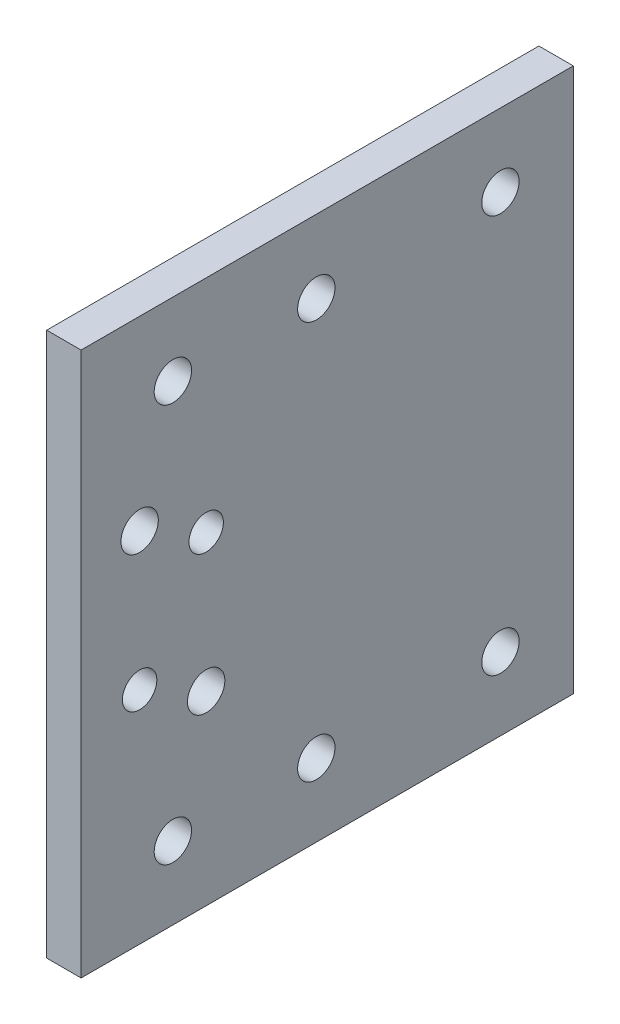
from build123d import *

# Parameters (mm, degrees)
SKETCH1_R           = 3
SKETCH1_R_2         = 3.25755
BOSS_EXTRUDE1_DEPTH = 6


with BuildPart() as part:
    # Sketch1 → Boss-Extrude1 (new body)
    with BuildSketch(Plane.YZ):
        Polygon((-47.4, -25), (-47.4, -69.8), (47.4, -69.8), (47.4, 16), (-47.4, 16), align=None)
        with Locations((-9, 5.8)):
            Circle(SKETCH1_R, mode=Mode.SUBTRACT)
        with Locations((-15, -5.8)):
            Circle(SKETCH1_R_2, mode=Mode.SUBTRACT)
        with Locations((9, -5.8)):
            Circle(SKETCH1_R, mode=Mode.SUBTRACT)
        with Locations((15, 5.8)):
            Circle(SKETCH1_R_2, mode=Mode.SUBTRACT)
        with Locations((-34.7, -57.1)):
            Circle(SKETCH1_R_2, mode=Mode.SUBTRACT)
        with Locations((34.7, -57.1)):
            Circle(SKETCH1_R_2, mode=Mode.SUBTRACT)
        with Locations((-34.7, -25)):
            Circle(SKETCH1_R_2, mode=Mode.SUBTRACT)
        with Locations((-34.7, 0)):
            Circle(SKETCH1_R_2, mode=Mode.SUBTRACT)
        with Locations((34.7, 0)):
            Circle(SKETCH1_R_2, mode=Mode.SUBTRACT)
        with Locations((34.7, -25)):
            Circle(SKETCH1_R_2, mode=Mode.SUBTRACT)
    extrude(amount=BOSS_EXTRUDE1_DEPTH)


solid = part.part
